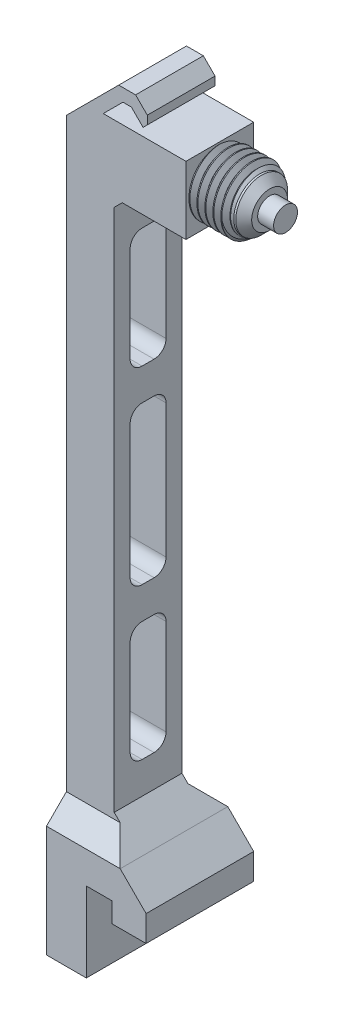
from build123d import *

# Parameters (mm, degrees)
SKETCH2_R                = 8
BOSS_EXTRUDE1_DEPTH      = 16
CHAMFER1_SIZE            = 1.5
CUT_SWEEP1_PITCH         = 2
BOSS_EXTRUDE2_DEPTH      = 10
SKETCH6_OUTSIDE_W        = 148.652
SKETCH6_OUTSIDE_H        = 152.364
SKETCH6_OUTSIDE_R        = 12
CUT_EXTRUDE1_DEPTH       = 32.811947604
CUT_EXTRUDE1_DRAFT       = -60
SKETCH7_W                = 0.526834602
SKETCH7_H                = 0.526834602
CUT_EXTRUDE2_DEPTH       = 0.25
SKETCH10_R               = 6.5
BOSS_EXTRUDE3_DEPTH      = 2.5
CHAMFER2_SIZE            = 2
SKETCH11_R               = 3
BOSS_EXTRUDE4_DEPTH      = 4
CUT_EXTRUDE3_DEPTH       = 6
CUT_EXTRUDE3_DEPTH_BACK  = 16
SKETCH13_W               = 51.662554117
SKETCH13_H               = 51.8746408
SKETCH14_W               = 17
SKETCH14_H               = 17
BOSS_EXTRUDE5_DEPTH      = 30
SKETCH15_W               = 12
SKETCH15_H               = 17
BOSS_EXTRUDE6_DEPTH      = 140
CHAMFER3_SIZE            = 5
BOSS_EXTRUDE7_DEPTH      = 5
BOSS_EXTRUDE7_DEPTH_BACK = 22
SKETCH18_R               = 1.75
CUT_EXTRUDE5_DEPTH       = 17
CHAMFER5_SIZE            = 2
BOSS_EXTRUDE8_DEPTH      = 17
CHAMFER7_SIZE            = 1.5
CHAMFER8_SIZE            = 1.5
CHAMFER10_SIZE           = 3
CHAMFER11_SIZE           = 6.5
SKETCH23_W               = 9
SKETCH23_H               = 30
SKETCH23_H_2             = 39.5
CUT_EXTRUDE7_DEPTH       = 20
FILLET1_R                = 3
CHAMFER12_SIZE           = 5
SKETCH25_W               = 27
SKETCH25_H               = 10
CUT_EXTRUDE8_DEPTH       = 10


# Some blends are built 0.0001 mm under size
with BuildPart() as part:
    # Sketch2 → Boss-Extrude1 (new body)
    with BuildSketch(Plane(origin=(13, 0, 0), x_dir=(0, 0, -1), z_dir=(1, 0, 0))):
        Circle(SKETCH2_R)
    extrude(amount=-BOSS_EXTRUDE1_DEPTH)

    # Chamfer1
    chamfer1_edges = [part.edges().sort_by_distance(p)[0] for p in [
        (13, 0, 8),
    ]]
    chamfer(chamfer1_edges, length=CHAMFER1_SIZE)

    # Cut-Sweep1: the profile of Sketch5 profile screwed along a right-hand helix of 9 turns, 10 arcs to a turn; built about Z, then put on its axis
    cut_sweep1_z = Axis((0, 0, 0), (0, 0, 1))
    cut_sweep1_corners = [(8.0003, 0, 0.000173205), (6.700961894, 0, -0.75), (6.700961894, 0, -1), (8.0003, 0, -1.750173205)]
    with BuildLine(mode=Mode.PRIVATE) as cut_sweep1_profile:
        Line(cut_sweep1_corners[0], cut_sweep1_corners[1])
        Line(cut_sweep1_corners[1], cut_sweep1_corners[2])
        Line(cut_sweep1_corners[2], cut_sweep1_corners[3])
        Line(cut_sweep1_corners[3], cut_sweep1_corners[0])
    cut_sweep1_cap = Face(cut_sweep1_profile.wire())
    cut_sweep1_turn_angles = [0, 18, 36, 54, 72, 90, 108, 126, 144, 162, 180, 198, 216, 234, 252, 270, 288, 306, 324, 342, 360]
    cut_sweep1_turn_weights = [1, 0.9510565162951535, 1, 0.9510565162951535, 1, 0.9510565162951535, 1, 0.9510565162951535, 1, 0.9510565162951535, 1, 0.9510565162951535, 1, 0.9510565162951535, 1, 0.9510565162951535, 1, 0.9510565162951535, 1, 0.9510565162951535, 1]
    cut_sweep1_turn_rails = [Edge.make_bspline([Vector(p[0], p[1], 0).rotate(cut_sweep1_z, cut_sweep1_turn_angles[k]) / cut_sweep1_turn_weights[k] + Vector(0, 0, p[2] + CUT_SWEEP1_PITCH * cut_sweep1_turn_angles[k] / 360) for k in range(21)], [0, 0, 0, 1, 1, 2, 2, 3, 3, 4, 4, 5, 5, 6, 6, 7, 7, 8, 8, 9, 9, 10, 10, 10], 2, cut_sweep1_turn_weights) for p in cut_sweep1_corners]
    cut_sweep1_turn_sides = [Face.make_surface_from_curves(cut_sweep1_turn_rails[p[0]], cut_sweep1_turn_rails[p[1]]) for p in [(0, 1), (1, 2), (2, 3), (3, 0)]]
    cut_sweep1 = Plane(origin=(13, 0, 0), x_dir=(0, 1, 0), z_dir=(-1, 0, 0)) * Solid(Shell([*[p.moved(Location((0, 0, CUT_SWEEP1_PITCH * i))) for i in range(9) for p in cut_sweep1_turn_sides], cut_sweep1_cap, cut_sweep1_cap.rotate(cut_sweep1_z, 3240).moved(Location((0, 0, CUT_SWEEP1_PITCH * 3240 / 360)))]))
    add(cut_sweep1, mode=Mode.SUBTRACT)

    # Sketch3 → Boss-Extrude2 (add)
    with BuildSketch(Plane.ZY.offset(3)):
        Polygon((-12, -6.92820323), (0, -13.856406461), (12, -6.92820323), (12, 6.92820323), (0, 13.856406461), (-12, 6.92820323), align=None)
    extrude(amount=BOSS_EXTRUDE2_DEPTH)


with BuildPart() as cut_extrude1_tool:
    # Sketch6 outside → Cut-Extrude1 (with draft: the straight prism first)
    with BuildSketch(Plane.ZY.offset(13)):
        Rectangle(SKETCH6_OUTSIDE_W, SKETCH6_OUTSIDE_H)
        Circle(SKETCH6_OUTSIDE_R, mode=Mode.SUBTRACT)
    extrude(amount=-CUT_EXTRUDE1_DEPTH)
    # Cut-Extrude1: the draft: its side faces are tilted about the plane it starts from
    cut_extrude1_sides = [cut_extrude1_tool.faces().sort_by_distance(p)[0] for p in [
        (3.405973802, -76.182, 0),
        (3.405973802, 0, 74.326),
        (3.405973802, 76.182, 0),
        (3.405973802, 0, -74.326),
        (3.405973802, 0, -12),
    ]]
    draft(cut_extrude1_sides, Plane.ZY.offset(13), CUT_EXTRUDE1_DRAFT)


with BuildPart() as part_1:
    add(part.part)

    # Cut-Extrude1: cut by cut_extrude1_tool
    add(cut_extrude1_tool.part, mode=Mode.SUBTRACT)

    # Sketch7 → Cut-Extrude2 (cut)
    # profile 1 of 3: a face of its own
    with BuildSketch(Plane.ZY.offset(13)):
        with BuildLine():
            add(Edge.make_bspline(
                [(-2.90746846, 8.253864282), (-2.957455761, 8.273419597), (-3.053297993, 8.310913621), (-3.182564454, 8.385949716), (-3.291967851, 8.472268863), (-3.380164855, 8.57195259), (-3.447387006, 8.682940162), (-3.495789612, 8.803816491), (-3.524139868, 8.935254994), (-3.52787109, 9.026141332), (-3.529791834, 9.072927452)],
                knots=[0, 0, 0, 0, 1.16287356, 2.229614231, 3.228817875, 4.173350329, 5.100165549, 6.029633206, 6.985702163, 8, 8, 8, 8], degree=3))
            add(Edge.make_bspline(
                [(-3.529791834, 9.072927452), (-3.528887829, 9.108927308), (-3.52711324, 9.179596151), (-3.511780384, 9.283290714), (-3.487222606, 9.382656048), (-3.452369373, 9.477411704), (-3.408703985, 9.568337609), (-3.353605629, 9.653767958), (-3.290273492, 9.736117188), (-3.216082902, 9.81205649), (-3.134326154, 9.881609542), (-3.045770837, 9.943504926), (-2.949739325, 9.994120304), (-2.847832737, 10.036439024), (-2.739547194, 10.069570108), (-2.624501257, 10.092134222), (-2.503100488, 10.106486672), (-2.419913797, 10.108354165), (-2.377341142, 10.109309896)],
                knots=[0, 0, 0, 0, 0.994101948, 1.951453197, 2.889123786, 3.817215529, 4.736003873, 5.669743943, 6.620499649, 7.601567446, 8.596478358, 9.582687259, 10.579761808, 11.589151689, 12.62747492, 13.702346593, 14.8241243, 16, 16, 16, 16], degree=3))
            add(Edge.make_bspline(
                [(-2.377341142, 10.109309896), (-2.334497209, 10.108344461), (-2.251042062, 10.106463903), (-2.128996315, 10.092304294), (-2.013224363, 10.068571907), (-1.903794367, 10.034901624), (-1.800533808, 9.991852141), (-1.704121208, 9.938938675), (-1.61356406, 9.877033937), (-1.531176973, 9.805399693), (-1.456214543, 9.727628198), (-1.391266679, 9.644308603), (-1.335562963, 9.557385115), (-1.289532211, 9.466329652), (-1.255478486, 9.370105339), (-1.229521904, 9.270525084), (-1.214465883, 9.16640568), (-1.212646439, 9.095749826), (-1.211719585, 9.059756587)],
                knots=[0, 0, 0, 0, 1.171211919, 2.281388661, 3.353996503, 4.398126828, 5.406889753, 6.407389155, 7.400009931, 8.40008733, 9.387021643, 10.349004252, 11.283445052, 12.206096336, 13.131640667, 14.068727932, 15.016178647, 16, 16, 16, 16], degree=3))
            add(Edge.make_bspline(
                [(-1.211719585, 9.059756587), (-1.213225231, 9.014582983), (-1.216177521, 8.926006043), (-1.246262671, 8.798321647), (-1.293152951, 8.679121865), (-1.360923555, 8.570678435), (-1.446752505, 8.471871382), (-1.553259386, 8.385977327), (-1.6788267, 8.311058501), (-1.772249066, 8.273442221), (-1.820872093, 8.253864282)],
                knots=[0, 0, 0, 0, 0.998680737, 1.958225066, 2.887911823, 3.823713378, 4.77537694, 5.772726054, 6.840782926, 8, 8, 8, 8], degree=3))
            add(Edge.make_bspline(
                [(-1.820872093, 8.253864282), (-1.79019412, 8.243450563), (-1.730078601, 8.223044193), (-1.645093194, 8.183367921), (-1.565081987, 8.140587482), (-1.489593789, 8.09427763), (-1.421415055, 8.040994413), (-1.358271142, 7.983888247), (-1.300427536, 7.922154392), (-1.248674318, 7.855267797), (-1.202469235, 7.784632296), (-1.162914017, 7.710075677), (-1.12932053, 7.632659156), (-1.100610379, 7.552023738), (-1.079639883, 7.467601437), (-1.064967108, 7.379780217), (-1.055657646, 7.289022928), (-1.05433891, 7.227382559), (-1.053669204, 7.196079182)],
                knots=[0, 0, 0, 0, 1.104208047, 2.163768705, 3.193778962, 4.198696312, 5.179575955, 6.14024585, 7.100368562, 8.060719304, 9.021161243, 9.975749006, 10.935506756, 11.897452199, 12.89163552, 13.897859372, 14.932451246, 16, 16, 16, 16], degree=3))
            add(Edge.make_bspline(
                [(-1.053669204, 7.196079182), (-1.054716175, 7.152934651), (-1.056778789, 7.067936635), (-1.074901557, 6.943169523), (-1.102322109, 6.823313686), (-1.142304439, 6.708875442), (-1.193371807, 6.599773891), (-1.25654276, 6.496167462), (-1.33119662, 6.398162731), (-1.41513123, 6.305455071), (-1.508970072, 6.221651361), (-1.610486318, 6.147801802), (-1.720060869, 6.08594338), (-1.83636421, 6.034724829), (-1.959953243, 5.995030642), (-2.090669101, 5.967236295), (-2.228468288, 5.950685984), (-2.322691104, 5.948454736), (-2.370755709, 5.94731654)],
                knots=[0, 0, 0, 0, 1.017598406, 2.004746413, 2.969099523, 3.915171376, 4.859468899, 5.806714415, 6.772805022, 7.762836953, 8.753334612, 9.736396794, 10.719437652, 11.716790048, 12.730404696, 13.776887535, 14.865953843, 16, 16, 16, 16], degree=3))
            add(Edge.make_bspline(
                [(-2.370755709, 5.94731654), (-2.418815506, 5.948479266), (-2.513028898, 5.9507586), (-2.650953985, 5.966970565), (-2.781482822, 5.996024904), (-2.904911159, 6.035759439), (-3.021908553, 6.085591242), (-3.130747206, 6.148843491), (-3.232926554, 6.222599489), (-3.326830646, 6.306921548), (-3.411462457, 6.39961932), (-3.485132215, 6.499071428), (-3.547928155, 6.603747336), (-3.599607851, 6.714237128), (-3.638999563, 6.83054181), (-3.666645135, 6.952224733), (-3.684800706, 7.079192912), (-3.686814092, 7.165831717), (-3.687842214, 7.210073227)],
                knots=[0, 0, 0, 0, 1.127066097, 2.209429196, 3.250843736, 4.258219581, 5.246860502, 6.227045772, 7.204057202, 8.19754525, 9.181483529, 10.142920909, 11.095356922, 12.039670968, 12.998174893, 13.969127444, 14.962948905, 16, 16, 16, 16], degree=3))
            add(Edge.make_bspline(
                [(-3.687842214, 7.210073227), (-3.687127592, 7.243014323), (-3.68572538, 7.307650453), (-3.677159739, 7.402454067), (-3.660088582, 7.492811877), (-3.638099844, 7.579256359), (-3.610181027, 7.662003775), (-3.575737853, 7.740404309), (-3.533949408, 7.814268475), (-3.486474995, 7.884076905), (-3.432715541, 7.949339516), (-3.373542362, 8.009484791), (-3.308740513, 8.063828617), (-3.239766209, 8.113958214), (-3.163728292, 8.156327559), (-3.08345459, 8.195209327), (-2.997564983, 8.228368266), (-2.937801408, 8.245280496), (-2.90746846, 8.253864282)],
                knots=[0, 0, 0, 0, 1.117345089, 2.192424383, 3.22371675, 4.232639188, 5.215561493, 6.182180952, 7.132172269, 8.089790513, 9.041830748, 9.996006267, 10.94686322, 11.907506267, 12.882866327, 13.894317773, 14.931262935, 16, 16, 16, 16], degree=3))
        make_face()
        with BuildLine():
            add(Edge.make_bspline(
                [(-3.002957232, 9.070457915), (-3.001393592, 9.028518187), (-2.998371948, 8.947472027), (-2.965511241, 8.832351895), (-2.914126632, 8.728941732), (-2.853887195, 8.653951076), (-2.796132704, 8.602856063), (-2.747928627, 8.568741739), (-2.695250893, 8.539779367), (-2.637717876, 8.517267984), (-2.576723028, 8.497324301), (-2.510162724, 8.486177232), (-2.439601423, 8.477115327), (-2.390820749, 8.476459034), (-2.365816635, 8.47612263)],
                knots=[0, 0, 0, 0, 1.528727296, 2.954179336, 4.335216052, 5.725683216, 6.435919001, 7.148062981, 7.879427438, 8.626027458, 9.402978632, 10.2190538, 11.08711833, 12, 12, 12, 12], degree=3))
            add(Edge.make_bspline(
                [(-2.365816635, 8.47612263), (-2.341364462, 8.476471465), (-2.293684066, 8.477151674), (-2.224711973, 8.486028834), (-2.159533586, 8.497885115), (-2.099112049, 8.515851487), (-2.0427498, 8.539213011), (-1.991363545, 8.568012002), (-1.943415562, 8.601110308), (-1.887357684, 8.652595684), (-1.827201376, 8.724959871), (-1.775644564, 8.823750554), (-1.743516554, 8.931833428), (-1.740237349, 9.00711945), (-1.738554187, 9.045762543)],
                knots=[0, 0, 0, 0, 0.922112375, 1.798068639, 2.620552757, 3.419964248, 4.17189205, 4.918165909, 5.639229138, 6.36503528, 7.785020832, 9.165298717, 10.544993853, 12, 12, 12, 12], degree=3))
            add(Edge.make_bspline(
                [(-1.738554187, 9.045762543), (-1.740582161, 9.085756489), (-1.744550382, 9.164014285), (-1.776599914, 9.276356879), (-1.830558107, 9.378105718), (-1.892197863, 9.452411454), (-1.949247403, 9.506241585), (-1.998056192, 9.540508068), (-2.050525824, 9.569671877), (-2.106855996, 9.593488053), (-2.167128165, 9.612696047), (-2.231505601, 9.625297416), (-2.29971779, 9.634135199), (-2.346578157, 9.63481039), (-2.370755709, 9.635158754)],
                knots=[0, 0, 0, 0, 1.480633456, 2.897216237, 4.289382554, 5.720567045, 6.454675042, 7.191244726, 7.924224627, 8.676083236, 9.454506446, 10.26432127, 11.104478565, 12, 12, 12, 12], degree=3))
            add(Edge.make_bspline(
                [(-2.370755709, 9.635158754), (-2.394935952, 9.634821657), (-2.442074155, 9.634164502), (-2.510731136, 9.625061514), (-2.575718677, 9.613628346), (-2.636437225, 9.595280228), (-2.692634394, 9.571303502), (-2.744897164, 9.542123313), (-2.793613474, 9.508732112), (-2.851063826, 9.457302353), (-2.911233604, 9.384936527), (-2.964241487, 9.287723649), (-2.997002074, 9.181728802), (-3.000947592, 9.108007613), (-3.002957232, 9.070457915)],
                knots=[0, 0, 0, 0, 0.914830409, 1.783417199, 2.618873138, 3.411020283, 4.179090249, 4.927874451, 5.674348476, 6.410336976, 7.841713217, 9.213201474, 10.580551314, 12, 12, 12, 12], degree=3))
        make_face(mode=Mode.SUBTRACT)
        with BuildLine():
            add(Edge.make_bspline(
                [(-3.161007612, 7.219951375), (-3.160096596, 7.186146782), (-3.158272165, 7.118448548), (-3.142267973, 7.017902325), (-3.115112176, 6.919228456), (-3.080307293, 6.822333737), (-3.031212842, 6.731129009), (-2.966108079, 6.649722079), (-2.884413795, 6.58128004), (-2.791114456, 6.523457608), (-2.689300888, 6.477946381), (-2.583208174, 6.446177999), (-2.475574511, 6.425187037), (-2.402955534, 6.422707609), (-2.366639814, 6.421467682)],
                knots=[0, 0, 0, 0, 0.957879255, 1.91828174, 2.876792425, 3.856375228, 4.831004356, 5.799187063, 6.79220414, 7.836856316, 8.902268238, 9.943090861, 10.971368942, 12, 12, 12, 12], degree=3))
            add(Edge.make_bspline(
                [(-2.366639814, 6.421467682), (-2.336693587, 6.421974949), (-2.278516605, 6.422960424), (-2.19371278, 6.434221596), (-2.113808404, 6.451308477), (-2.038437399, 6.474737393), (-1.968709142, 6.506789699), (-1.903488138, 6.544251883), (-1.843441512, 6.589527801), (-1.788586265, 6.641199051), (-1.739481094, 6.698357137), (-1.697416305, 6.760018224), (-1.660722693, 6.824448243), (-1.630764036, 6.893037694), (-1.609099099, 6.965928014), (-1.59238154, 7.041804104), (-1.582296331, 7.121448584), (-1.581109974, 7.175745055), (-1.580503806, 7.203487794)],
                knots=[0, 0, 0, 0, 1.149387474, 2.232932207, 3.278773642, 4.285224938, 5.256757121, 6.220082341, 7.168479488, 8.137608443, 9.109140627, 10.056190326, 10.999892409, 11.953252726, 12.923240661, 13.915357002, 14.934853301, 16, 16, 16, 16], degree=3))
            add(Edge.make_bspline(
                [(-1.580503806, 7.203487794), (-1.581129279, 7.23177509), (-1.582353856, 7.287157111), (-1.592182767, 7.368549623), (-1.60983774, 7.44576064), (-1.632542108, 7.519956596), (-1.663313019, 7.589846693), (-1.700249189, 7.656433072), (-1.745480992, 7.717960665), (-1.795081271, 7.776518342), (-1.851212178, 7.829526575), (-1.913198269, 7.875237577), (-1.979075062, 7.915608134), (-2.050835392, 7.946575759), (-2.12689828, 7.971381533), (-2.207625089, 7.989405785), (-2.293344966, 8.000423531), (-2.352062701, 8.001445539), (-2.382280216, 8.001971488)],
                knots=[0, 0, 0, 0, 1.065858887, 2.086781919, 3.082735321, 4.047496077, 5.006086125, 5.955204095, 6.910833714, 7.878747924, 8.844339535, 9.812198509, 10.776903849, 11.749116737, 12.749729282, 13.788304076, 14.861809717, 16, 16, 16, 16], degree=3))
            add(Edge.make_bspline(
                [(-2.382280216, 8.001971488), (-2.411677154, 8.001440305), (-2.469304308, 8.000399021), (-2.553020633, 7.989318865), (-2.632274273, 7.972303419), (-2.70636795, 7.94739905), (-2.776228064, 7.91627851), (-2.840576899, 7.877146657), (-2.900562432, 7.831725742), (-2.95435232, 7.778932568), (-3.002884738, 7.721584828), (-3.044846212, 7.660108226), (-3.08191492, 7.595928837), (-3.110045581, 7.526940699), (-3.133855666, 7.455374075), (-3.148740736, 7.379839932), (-3.15932216, 7.301196471), (-3.160437583, 7.247428898), (-3.161007612, 7.219951375)],
                knots=[0, 0, 0, 0, 1.135239447, 2.225422834, 3.256957183, 4.262780498, 5.240265059, 6.205773948, 7.16638056, 8.141101257, 9.111719309, 10.064571387, 11.014055337, 11.969087385, 12.938082716, 13.92369833, 14.938921288, 16, 16, 16, 16], degree=3))
        make_face(mode=Mode.SUBTRACT)
    # profile 2 of 3: a face of its own
    with BuildSketch(Plane.ZY.offset(13)):
        with Locations((0, 6.263417301)):
            Rectangle(SKETCH7_W, SKETCH7_H)
    # profile 3 of 3: a face of its own
    with BuildSketch(Plane.ZY.offset(13)):
        with BuildLine():
            add(Edge.make_bspline(
                [(1.834042958, 8.253864282), (1.784055657, 8.273419597), (1.688213426, 8.310913621), (1.558946964, 8.385949716), (1.449543567, 8.472268863), (1.361346564, 8.57195259), (1.294124412, 8.682940162), (1.245721806, 8.803816491), (1.21737155, 8.935254994), (1.213640329, 9.026141332), (1.211719585, 9.072927452)],
                knots=[0, 0, 0, 0, 1.16287356, 2.229614231, 3.228817875, 4.173350329, 5.100165549, 6.029633206, 6.985702163, 8, 8, 8, 8], degree=3))
            add(Edge.make_bspline(
                [(1.211719585, 9.072927452), (1.212623589, 9.108927308), (1.214398179, 9.179596151), (1.229731035, 9.283290714), (1.254288812, 9.382656048), (1.289142045, 9.477411704), (1.332807433, 9.568337609), (1.387905789, 9.653767958), (1.451237927, 9.736117188), (1.525428517, 9.81205649), (1.607185264, 9.881609542), (1.695740581, 9.943504926), (1.791772093, 9.994120304), (1.893678681, 10.036439024), (2.001964224, 10.069570108), (2.117010161, 10.092134222), (2.238410931, 10.106486672), (2.321597621, 10.108354165), (2.364170277, 10.109309896)],
                knots=[0, 0, 0, 0, 0.994101948, 1.951453197, 2.889123786, 3.817215529, 4.736003873, 5.669743943, 6.620499649, 7.601567446, 8.596478358, 9.582687259, 10.579761808, 11.589151689, 12.62747492, 13.702346593, 14.8241243, 16, 16, 16, 16], degree=3))
            add(Edge.make_bspline(
                [(2.364170277, 10.109309896), (2.40701421, 10.108344461), (2.490469356, 10.106463903), (2.612515104, 10.092304294), (2.728287055, 10.068571907), (2.837717051, 10.034901624), (2.940977611, 9.991852141), (3.03739021, 9.938938675), (3.127947358, 9.877033937), (3.210334446, 9.805399693), (3.285296875, 9.727628198), (3.350244739, 9.644308603), (3.405948456, 9.557385115), (3.451979208, 9.466329652), (3.486032932, 9.370105339), (3.511989514, 9.270525084), (3.527045535, 9.16640568), (3.528864979, 9.095749826), (3.529791834, 9.059756587)],
                knots=[0, 0, 0, 0, 1.171211919, 2.281388661, 3.353996503, 4.398126828, 5.406889753, 6.407389155, 7.400009931, 8.40008733, 9.387021643, 10.349004252, 11.283445052, 12.206096336, 13.131640667, 14.068727932, 15.016178647, 16, 16, 16, 16], degree=3))
            add(Edge.make_bspline(
                [(3.529791834, 9.059756587), (3.528286187, 9.014582983), (3.525333898, 8.926006043), (3.495248747, 8.798321647), (3.448358467, 8.679121865), (3.380587863, 8.570678435), (3.294758913, 8.471871382), (3.188252032, 8.385977327), (3.062684719, 8.311058501), (2.969262352, 8.273442221), (2.920639325, 8.253864282)],
                knots=[0, 0, 0, 0, 0.998680737, 1.958225066, 2.887911823, 3.823713378, 4.77537694, 5.772726054, 6.840782926, 8, 8, 8, 8], degree=3))
            add(Edge.make_bspline(
                [(2.920639325, 8.253864282), (2.951317299, 8.243450563), (3.011432817, 8.223044193), (3.096418225, 8.183367921), (3.176429431, 8.140587482), (3.251917629, 8.09427763), (3.320096363, 8.040994413), (3.383240276, 7.983888247), (3.441083882, 7.922154392), (3.4928371, 7.855267797), (3.539042183, 7.784632296), (3.578597401, 7.710075677), (3.612190888, 7.632659156), (3.640901039, 7.552023738), (3.661871535, 7.467601437), (3.67654431, 7.379780217), (3.685853772, 7.289022928), (3.687172509, 7.227382559), (3.687842214, 7.196079182)],
                knots=[0, 0, 0, 0, 1.104208047, 2.163768705, 3.193778962, 4.198696312, 5.179575955, 6.14024585, 7.100368562, 8.060719304, 9.021161243, 9.975749006, 10.935506756, 11.897452199, 12.89163552, 13.897859372, 14.932451246, 16, 16, 16, 16], degree=3))
            add(Edge.make_bspline(
                [(3.687842214, 7.196079182), (3.686795243, 7.152934651), (3.68473263, 7.067936635), (3.666609861, 6.943169523), (3.639189309, 6.823313686), (3.59920698, 6.708875442), (3.548139611, 6.599773891), (3.484968658, 6.496167462), (3.410314798, 6.398162731), (3.326380189, 6.305455071), (3.232541346, 6.221651361), (3.1310251, 6.147801802), (3.02145055, 6.08594338), (2.905147208, 6.034724829), (2.781558176, 5.995030642), (2.650842317, 5.967236295), (2.51304313, 5.950685984), (2.418820314, 5.948454736), (2.370755709, 5.94731654)],
                knots=[0, 0, 0, 0, 1.017598406, 2.004746413, 2.969099523, 3.915171376, 4.859468899, 5.806714415, 6.772805022, 7.762836953, 8.753334612, 9.736396794, 10.719437652, 11.716790048, 12.730404696, 13.776887535, 14.865953843, 16, 16, 16, 16], degree=3))
            add(Edge.make_bspline(
                [(2.370755709, 5.94731654), (2.322695912, 5.948479266), (2.22848252, 5.9507586), (2.090557433, 5.966970565), (1.960028596, 5.996024904), (1.836600259, 6.035759439), (1.719602865, 6.085591242), (1.610764212, 6.148843491), (1.508584864, 6.222599489), (1.414680772, 6.306921548), (1.330048961, 6.39961932), (1.256379203, 6.499071428), (1.193583263, 6.603747336), (1.141903568, 6.714237128), (1.102511855, 6.83054181), (1.074866284, 6.952224733), (1.056710712, 7.079192912), (1.054697326, 7.165831717), (1.053669204, 7.210073227)],
                knots=[0, 0, 0, 0, 1.127066097, 2.209429196, 3.250843736, 4.258219581, 5.246860502, 6.227045772, 7.204057202, 8.19754525, 9.181483529, 10.142920909, 11.095356922, 12.039670968, 12.998174893, 13.969127444, 14.962948905, 16, 16, 16, 16], degree=3))
            add(Edge.make_bspline(
                [(1.053669204, 7.210073227), (1.054383826, 7.243014323), (1.055786039, 7.307650453), (1.064351679, 7.402454067), (1.081422836, 7.492811877), (1.103411574, 7.579256359), (1.131330391, 7.662003775), (1.165773565, 7.740404309), (1.20756201, 7.814268475), (1.255036423, 7.884076905), (1.308795877, 7.949339516), (1.367969057, 8.009484791), (1.432770905, 8.063828617), (1.50174521, 8.113958214), (1.577783126, 8.156327559), (1.658056829, 8.195209327), (1.743946435, 8.228368266), (1.803710011, 8.245280496), (1.834042958, 8.253864282)],
                knots=[0, 0, 0, 0, 1.117345089, 2.192424383, 3.22371675, 4.232639188, 5.215561493, 6.182180952, 7.132172269, 8.089790513, 9.041830748, 9.996006267, 10.94686322, 11.907506267, 12.882866327, 13.894317773, 14.931262935, 16, 16, 16, 16], degree=3))
        make_face()
        with BuildLine():
            add(Edge.make_bspline(
                [(1.738554187, 9.070457915), (1.740117826, 9.028518187), (1.74313947, 8.947472027), (1.776000177, 8.832351895), (1.827384786, 8.728941732), (1.887624223, 8.653951076), (1.945378714, 8.602856063), (1.993582791, 8.568741739), (2.046260525, 8.539779367), (2.103793542, 8.517267984), (2.16478839, 8.497324301), (2.231348695, 8.486177232), (2.301909995, 8.477115327), (2.350690669, 8.476459034), (2.375694784, 8.47612263)],
                knots=[0, 0, 0, 0, 1.528727296, 2.954179336, 4.335216052, 5.725683216, 6.435919001, 7.148062981, 7.879427438, 8.626027458, 9.402978632, 10.2190538, 11.08711833, 12, 12, 12, 12], degree=3))
            add(Edge.make_bspline(
                [(2.375694784, 8.47612263), (2.400146956, 8.476471465), (2.447827353, 8.477151674), (2.516799445, 8.486028834), (2.581977833, 8.497885115), (2.642399369, 8.515851487), (2.698761618, 8.539213011), (2.750147873, 8.568012002), (2.798095856, 8.601110308), (2.854153735, 8.652595684), (2.914310042, 8.724959871), (2.965866854, 8.823750554), (2.997994864, 8.931833428), (3.001274069, 9.00711945), (3.002957232, 9.045762543)],
                knots=[0, 0, 0, 0, 0.922112375, 1.798068639, 2.620552757, 3.419964248, 4.17189205, 4.918165909, 5.639229138, 6.36503528, 7.785020832, 9.165298717, 10.544993853, 12, 12, 12, 12], degree=3))
            add(Edge.make_bspline(
                [(3.002957232, 9.045762543), (3.000929257, 9.085756489), (2.996961037, 9.164014285), (2.964911505, 9.276356879), (2.910953311, 9.378105718), (2.849313555, 9.452411454), (2.792264016, 9.506241585), (2.743455226, 9.540508068), (2.690985595, 9.569671877), (2.634655423, 9.593488053), (2.574383254, 9.612696047), (2.510005817, 9.625297416), (2.441793628, 9.634135199), (2.394933261, 9.63481039), (2.370755709, 9.635158754)],
                knots=[0, 0, 0, 0, 1.480633456, 2.897216237, 4.289382554, 5.720567045, 6.454675042, 7.191244726, 7.924224627, 8.676083236, 9.454506446, 10.26432127, 11.104478565, 12, 12, 12, 12], degree=3))
            add(Edge.make_bspline(
                [(2.370755709, 9.635158754), (2.346575466, 9.634821657), (2.299437263, 9.634164502), (2.230780282, 9.625061514), (2.165792742, 9.613628346), (2.105074193, 9.595280228), (2.048877024, 9.571303502), (1.996614254, 9.542123313), (1.947897945, 9.508732112), (1.890447592, 9.457302353), (1.830277814, 9.384936527), (1.777269931, 9.287723649), (1.744509344, 9.181728802), (1.740563826, 9.108007613), (1.738554187, 9.070457915)],
                knots=[0, 0, 0, 0, 0.914830409, 1.783417199, 2.618873138, 3.411020283, 4.179090249, 4.927874451, 5.674348476, 6.410336976, 7.841713217, 9.213201474, 10.580551314, 12, 12, 12, 12], degree=3))
        make_face(mode=Mode.SUBTRACT)
        with BuildLine():
            add(Edge.make_bspline(
                [(1.580503806, 7.219951375), (1.581414822, 7.186146782), (1.583239254, 7.118448548), (1.599243445, 7.017902325), (1.626399243, 6.919228456), (1.661204125, 6.822333737), (1.710298576, 6.731129009), (1.775403339, 6.649722079), (1.857097623, 6.58128004), (1.950396963, 6.523457608), (2.05221053, 6.477946381), (2.158303244, 6.446177999), (2.265936907, 6.425187037), (2.338555885, 6.422707609), (2.374871604, 6.421467682)],
                knots=[0, 0, 0, 0, 0.957879255, 1.91828174, 2.876792425, 3.856375228, 4.831004356, 5.799187063, 6.79220414, 7.836856316, 8.902268238, 9.943090861, 10.971368942, 12, 12, 12, 12], degree=3))
            add(Edge.make_bspline(
                [(2.374871604, 6.421467682), (2.404817831, 6.421974949), (2.462994814, 6.422960424), (2.547798639, 6.434221596), (2.627703014, 6.451308477), (2.703074019, 6.474737393), (2.772802276, 6.506789699), (2.83802328, 6.544251883), (2.898069906, 6.589527801), (2.952925154, 6.641199051), (3.002030325, 6.698357137), (3.044095113, 6.760018224), (3.080788725, 6.824448243), (3.110747382, 6.893037694), (3.132412319, 6.965928014), (3.149129878, 7.041804104), (3.159215087, 7.121448584), (3.160401444, 7.175745055), (3.161007612, 7.203487794)],
                knots=[0, 0, 0, 0, 1.149387474, 2.232932207, 3.278773642, 4.285224938, 5.256757121, 6.220082341, 7.168479488, 8.137608443, 9.109140627, 10.056190326, 10.999892409, 11.953252726, 12.923240661, 13.915357002, 14.934853301, 16, 16, 16, 16], degree=3))
            add(Edge.make_bspline(
                [(3.161007612, 7.203487794), (3.160382139, 7.23177509), (3.159157562, 7.287157111), (3.149328651, 7.368549623), (3.131673678, 7.44576064), (3.10896931, 7.519956596), (3.078198399, 7.589846693), (3.041262229, 7.656433072), (2.996030426, 7.717960665), (2.946430147, 7.776518342), (2.89029924, 7.829526575), (2.82831315, 7.875237577), (2.762436356, 7.915608134), (2.690676027, 7.946575759), (2.614613138, 7.971381533), (2.533886329, 7.989405785), (2.448166453, 8.000423531), (2.389448718, 8.001445539), (2.359231202, 8.001971488)],
                knots=[0, 0, 0, 0, 1.065858887, 2.086781919, 3.082735321, 4.047496077, 5.006086125, 5.955204095, 6.910833714, 7.878747924, 8.844339535, 9.812198509, 10.776903849, 11.749116737, 12.749729282, 13.788304076, 14.861809717, 16, 16, 16, 16], degree=3))
            add(Edge.make_bspline(
                [(2.359231202, 8.001971488), (2.329834264, 8.001440305), (2.27220711, 8.000399021), (2.188490785, 7.989318865), (2.109237146, 7.972303419), (2.035143469, 7.94739905), (1.965283354, 7.91627851), (1.900934519, 7.877146657), (1.840948987, 7.831725742), (1.787159099, 7.778932568), (1.73862668, 7.721584828), (1.696665207, 7.660108226), (1.659596498, 7.595928837), (1.631465838, 7.526940699), (1.607655752, 7.455374075), (1.592770682, 7.379839932), (1.582189258, 7.301196471), (1.581073835, 7.247428898), (1.580503806, 7.219951375)],
                knots=[0, 0, 0, 0, 1.135239447, 2.225422834, 3.256957183, 4.262780498, 5.240265059, 6.205773948, 7.16638056, 8.141101257, 9.111719309, 10.064571387, 11.014055337, 11.969087385, 12.938082716, 13.92369833, 14.938921288, 16, 16, 16, 16], degree=3))
        make_face(mode=Mode.SUBTRACT)
    extrude(amount=-CUT_EXTRUDE2_DEPTH, mode=Mode.SUBTRACT)

    # Sketch10 → Boss-Extrude3 (add)
    with BuildSketch(Plane(origin=(13, 0, 0), x_dir=(0, 0, -1), z_dir=(1, 0, 0))):
        Circle(SKETCH10_R)
    extrude(amount=BOSS_EXTRUDE3_DEPTH)

    # Chamfer2
    chamfer2_edges = [part_1.edges().sort_by_distance(p)[0] for p in [
        (15.5, 0, 6.5),
    ]]
    chamfer(chamfer2_edges, length=CHAMFER2_SIZE)

    # Sketch11 → Boss-Extrude4 (add)
    with BuildSketch(Plane(origin=(15.5, 0, 0), x_dir=(0, 0, -1), z_dir=(1, 0, 0))):
        Circle(SKETCH11_R)
    extrude(amount=BOSS_EXTRUDE4_DEPTH)

    # Sketch13 → Cut-Extrude3 (cut, two sides: drawn at the far end of the back side and taken through both)
    with BuildSketch(Plane(origin=(-3, 0, 0), x_dir=(0, 0, -1), z_dir=(1, 0, 0)).offset(-CUT_EXTRUDE3_DEPTH_BACK)):
        with Locations((-2.059479987, 0.489410433)):
            Rectangle(SKETCH13_W, SKETCH13_H)
    extrude(amount=CUT_EXTRUDE3_DEPTH + CUT_EXTRUDE3_DEPTH_BACK, mode=Mode.SUBTRACT)

    # Sketch14 → Boss-Extrude5 (add)
    with BuildSketch(Plane.ZY.offset(-3)):
        Rectangle(SKETCH14_W, SKETCH14_H)
    extrude(amount=BOSS_EXTRUDE5_DEPTH)

    # Sketch15 → Boss-Extrude6 (add)
    with BuildSketch(Plane.XZ.offset(8.5)):
        with Locations((-21, 0)):
            Rectangle(SKETCH15_W, SKETCH15_H)
    extrude(amount=BOSS_EXTRUDE6_DEPTH)

    # Chamfer3
    chamfer3_edges = [part_1.edges().sort_by_distance(p)[0] for p in [
        (-27, 8.5, 0),
    ]]
    chamfer(chamfer3_edges, length=CHAMFER3_SIZE)

    # Sketch17 → Boss-Extrude7 (add, two sides: drawn at the far end of the back side and taken through both)
    with BuildSketch(Plane.XY.offset(8.5).offset(-BOSS_EXTRUDE7_DEPTH_BACK)):
        Polygon((-27, -148.5), (-7, -148.5), (-2, -148.5), (-2, -161.5), (-10.5, -161.5), (-10.5, -156.5), (-17, -156.5), (-17, -186.5), (-27, -186.5), align=None)
    extrude(amount=BOSS_EXTRUDE7_DEPTH + BOSS_EXTRUDE7_DEPTH_BACK)

    # Sketch18 → Cut-Extrude5 (cut)
    with BuildSketch(Plane.ZY.offset(27)):
        with Locations((0, -164.5)):
            Circle(SKETCH18_R)
    extrude(amount=-CUT_EXTRUDE5_DEPTH, mode=Mode.SUBTRACT)

    # Chamfer5
    chamfer5_edges = [part_1.edges().sort_by_distance(p)[0] for p in [
        (-15, -8.5, 0),
    ]]
    chamfer(chamfer5_edges, length=CHAMFER5_SIZE)

    # Sketch20 → Boss-Extrude8 (add)
    with BuildSketch(Plane.XY.offset(8.5)):
        Polygon((-22, 8.5), (-11.757359313, 18.742640687), (-5.636038969, 12.621320344), (-7.757359313, 10.5), (-11.757359313, 14.5), (-17.757359313, 8.5), align=None)
    extrude(amount=-BOSS_EXTRUDE8_DEPTH)

    # Chamfer7
    chamfer7_edges = [part_1.edges().sort_by_distance(p)[0] for p in [
        (-11.757359313, 14.5, 0),
    ]]
    chamfer(chamfer7_edges, length=CHAMFER7_SIZE)

    # Chamfer8
    chamfer8_edges = [part_1.edges().sort_by_distance(p)[0] for p in [
        (-5.636038969, 12.621320344, 0),
    ]]
    chamfer(chamfer8_edges, length=CHAMFER8_SIZE)

    # Chamfer10
    chamfer10_edges = [part_1.edges().sort_by_distance(p)[0] for p in [
        (-11.757359313, 18.742640687, 0),
    ]]
    chamfer(chamfer10_edges, length=CHAMFER10_SIZE)

    # Chamfer11
    # the kernel refuses this chamfer: 6.5 mm, written as the material it adds along each edge
    with BuildSketch(Plane(origin=(-15, -148.5, -8.5), x_dir=(0.9996219169112965, -0.027495876610590667, 0), z_dir=(0, 0, 1))) as chamfer11_piece_1:
        Polygon((CHAMFER11_SIZE * 0.999621916911, CHAMFER11_SIZE * 0.0274958766106), (-CHAMFER11_SIZE * 0.0274958766106, CHAMFER11_SIZE * 0.999621916911), (0, 0), align=None)
    extrude(amount=17)
    # the kernel refuses this chamfer: 6.5 mm, written as the material it takes off along each edge
    with BuildSketch(Plane(origin=(-2, -148.5, 30.215939422), x_dir=(0.027495876610586358, -0.9996219169112968, 0), z_dir=(0, 0, -1))) as chamfer11_2_piece_1:
        Polygon((CHAMFER11_SIZE * 0.999621916911, CHAMFER11_SIZE * 0.0274958766106), (-CHAMFER11_SIZE * 0.0274958766106, CHAMFER11_SIZE * 0.999621916911), (0, 0), align=None)
    extrude(amount=60.431878844, mode=Mode.SUBTRACT)

    # Sketch23 → Cut-Extrude7 (cut)
    with BuildSketch(Plane(origin=(-15, 0, 0), x_dir=(0, 0, -1), z_dir=(1, 0, 0))):
        with Locations((0, -33.5)):
            Rectangle(SKETCH23_W, SKETCH23_H)
        with Locations((0, -76.25)):
            Rectangle(SKETCH23_W, SKETCH23_H_2)
        with Locations((0, -119)):
            Rectangle(SKETCH23_W, SKETCH23_H)
    extrude(amount=-CUT_EXTRUDE7_DEPTH, mode=Mode.SUBTRACT)

    # Fillet1
    fillet1_edges = [part_1.edges().sort_by_distance(p)[0] for p in [
        (-21, -18.5, -4.5),
        (-21, -48.5, -4.5),
        (-21, -48.5, 4.5),
        (-21, -18.5, 4.5),
        (-21, -134, 4.5),
        (-21, -104, 4.5),
        (-21, -104, -4.5),
        (-21, -134, -4.5),
        (-21, -96, 4.5),
        (-21, -56.5, 4.5),
        (-21, -56.5, -4.5),
        (-21, -96, -4.5),
    ]]
    fillet(fillet1_edges, radius=FILLET1_R)

    # Chamfer12
    chamfer12_edges = [part_1.edges().sort_by_distance(p)[0] for p in [
        (-17.75, -148.5, 8.5),
        (-17.75, -148.5, -8.5),
    ]]
    chamfer(chamfer12_edges, length=CHAMFER12_SIZE - 0.0001)  # a hair under: the kernel refuses the full size

    # Sketch25 → Cut-Extrude8 (cut)
    with BuildSketch(Plane.ZY.offset(27)):
        with Locations((0, -181.5)):
            Rectangle(SKETCH25_W, SKETCH25_H)
    extrude(amount=-CUT_EXTRUDE8_DEPTH, mode=Mode.SUBTRACT)


solid = part_1.part
